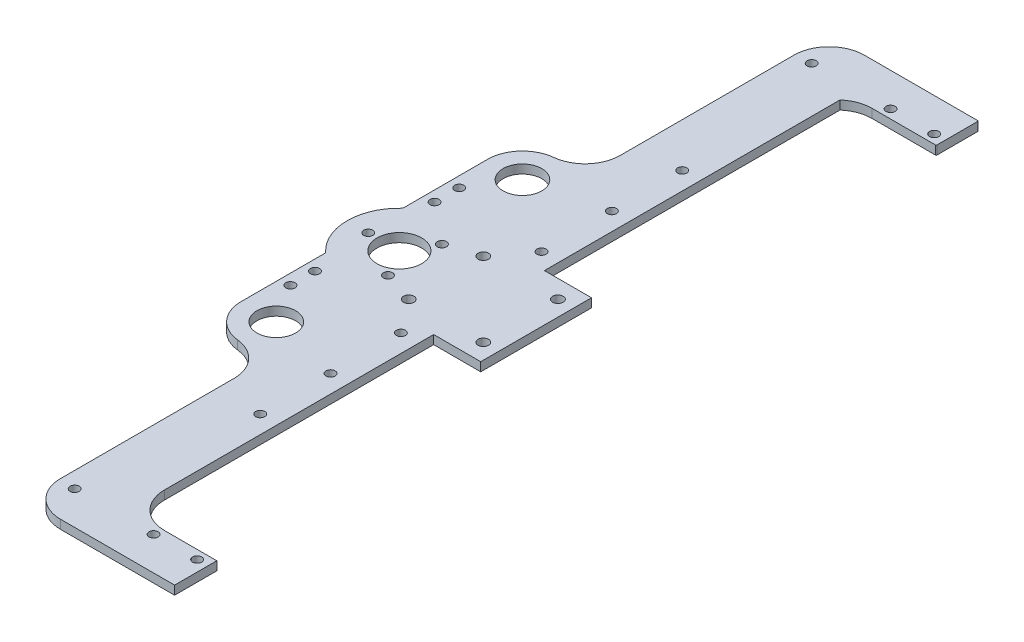
from build123d import *

# Parameters (mm, degrees)
SKETCH1_R           = 6.985
SKETCH1_R_2         = 1.6499967
SKETCH1_R_3         = 8.0645
BOSS_EXTRUDE1_DEPTH = 3.175
FILLET2_R           = 0.254
SKETCH4_R           = 1.65
CUT_EXTRUDE1_DEPTH  = 199.349545248
SKETCH5_R           = 1.89865
CUT_EXTRUDE2_DEPTH  = 199.349545248


with BuildPart() as part:
    # Sketch1 → Boss-Extrude1 (new body)
    with BuildSketch(Plane(origin=(0, 0, 0), x_dir=(1, 0, 0), z_dir=(0, 1, 0))):
        with BuildLine():
            ThreePointArc((-67.971311517, -24.866245744), (-74.128017531, -38.797272158), (-67.971311517, -52.728298572))
            Line((-67.971311517, -52.728298572), (-67.971311517, -82.586411585))
            ThreePointArc((-67.971311517, -82.586411585), (-64.941959488, -91.499608698), (-56.608448003, -95.878494725))
            ThreePointArc((-56.608448003, -95.878494725), (-48.492989851, -100.008926653), (-45.228378476, -108.509717293))
            Line((-45.228378476, -108.509717293), (-45.228378476, -171.249717293))
            ThreePointArc((-45.228378476, -171.249717293), (-41.508634597, -180.229973414), (-32.528378476, -183.949717293))
            Line((-32.528378476, -183.949717293), (7.398418219, -183.949717293))
            Line((7.398418219, -183.949717293), (8.682280525, -183.949717293))
            Line((8.682280525, -183.949717293), (8.682280525, -168.709717293))
            Line((8.682280525, -168.709717293), (-10.203517531, -168.709717293))
            ThreePointArc((-10.203517531, -168.709717293), (-19.183773652, -164.989973414), (-22.903517531, -156.009717293))
            Line((-22.903517531, -156.009717293), (-22.903517531, -64.197272158))
            Line((-22.903517531, -64.197272158), (-22.903517531, -58.797272158))
            Line((-22.903517531, -58.797272158), (-5.903517531, -58.797272158))
            Line((-5.903517531, -58.797272158), (-5.903517531, -38.797272158))
            Line((-5.903517531, -38.797272158), (-5.903517531, -18.797272158))
            Line((-5.903517531, -18.797272158), (-22.903517531, -18.797272158))
            Line((-22.903517531, -18.797272158), (-22.903517531, 87.951188553))
            ThreePointArc((-22.903517531, 87.951188553), (-18.998096245, 90.297878852), (-14.51576414, 91.115172977))
            Line((-14.51576414, 91.115172977), (8.682280525, 91.115172977))
            Line((8.682280525, 91.115172977), (8.682280525, 106.355172977))
            Line((8.682280525, 106.355172977), (-7.110618503, 106.355172977))
            Line((-7.110618503, 106.355172977), (-22.903517531, 106.355172977))
            Line((-22.903517531, 106.355172977), (-32.528378476, 106.355172977))
            ThreePointArc((-32.528378476, 106.355172977), (-41.508634597, 102.635429098), (-45.228378476, 93.655172977))
            Line((-45.228378476, 93.655172977), (-45.228378476, 30.915172977))
            ThreePointArc((-45.228378476, 30.915172977), (-48.492989851, 22.414382337), (-56.608448003, 18.28395041))
            ThreePointArc((-56.608448003, 18.28395041), (-64.941959488, 13.905064383), (-67.971311517, 4.991867269))
            Line((-67.971311517, 4.991867269), (-67.971311517, -24.866245744))
        make_face()
        with Locations((-55.288517531, -83.247272158)):
            Circle(SKETCH1_R, mode=Mode.SUBTRACT)
        with Locations((-64.161311517, -69.277272158)):
            Circle(SKETCH1_R_2, mode=Mode.SUBTRACT)
        with Locations((-64.161311517, -60.387272158)):
            Circle(SKETCH1_R_2, mode=Mode.SUBTRACT)
        with Locations((-66.528017531, -38.797272158)):
            Circle(SKETCH1_R_2, mode=Mode.SUBTRACT)
        with Locations((-55.288517531, -38.797272158)):
            Circle(SKETCH1_R_3, mode=Mode.SUBTRACT)
        with Locations((-49.668767531, -48.530964684)):
            Circle(SKETCH1_R_2, mode=Mode.SUBTRACT)
        with Locations((-29.342032123, -114.997272158)):
            Circle(SKETCH1_R_2, mode=Mode.SUBTRACT)
        with Locations((-29.342032123, -89.597272158)):
            Circle(SKETCH1_R_2, mode=Mode.SUBTRACT)
        with Locations((-29.342032123, -64.197272158)):
            Circle(SKETCH1_R_2, mode=Mode.SUBTRACT)
        with Locations((-64.161311517, -17.207272158)):
            Circle(SKETCH1_R_2, mode=Mode.SUBTRACT)
        with Locations((-64.161311517, -8.317272158)):
            Circle(SKETCH1_R_2, mode=Mode.SUBTRACT)
        with Locations((-55.288517531, 5.652727842)):
            Circle(SKETCH1_R, mode=Mode.SUBTRACT)
        with Locations((-49.668767531, -29.063579632)):
            Circle(SKETCH1_R_2, mode=Mode.SUBTRACT)
        with Locations((-29.342032123, -13.397272158)):
            Circle(SKETCH1_R_2, mode=Mode.SUBTRACT)
        with Locations((-29.342032123, 12.002727842)):
            Circle(SKETCH1_R_2, mode=Mode.SUBTRACT)
        with Locations((-29.342032123, 37.402727842)):
            Circle(SKETCH1_R_2, mode=Mode.SUBTRACT)
    extrude(amount=BOSS_EXTRUDE1_DEPTH)

    # Fillet2
    fillet2_edges = [part.edges().sort_by_distance(p)[0] for p in [
        (8.682280525, 1.5875, -91.115172977),
        (8.682280525, 1.5875, -106.355172977),
    ]]
    fillet(fillet2_edges, radius=FILLET2_R)

    # Sketch4 → Cut-Extrude1 (cut, through all)
    with BuildSketch(Plane(origin=(0, 3.175, 0), x_dir=(1, 0, 0), z_dir=(0, 1, 0))):
        with Locations((4.753970241, 94.290172977)):
            Circle(SKETCH4_R)
        with Locations((-10.971029759, 94.290172977)):
            Circle(SKETCH4_R)
        with Locations((-39.471029759, 94.290172977)):
            Circle(SKETCH4_R)
        with Locations((-39.471029759, -171.884717293)):
            Circle(SKETCH4_R)
        with Locations((-10.971029759, -171.884717293)):
            Circle(SKETCH4_R)
        with Locations((4.753970241, -171.884717293)):
            Circle(SKETCH4_R)
    extrude(amount=-CUT_EXTRUDE1_DEPTH, mode=Mode.SUBTRACT)

    # Sketch5 → Cut-Extrude2 (cut, through all)
    with BuildSketch(Plane(origin=(0, 3.175, 0), x_dir=(1, 0, 0), z_dir=(0, 1, 0))):
        with Locations((-11.500645577, -25.326887976)):
            Circle(SKETCH5_R)
        with Locations((-38.441413941, -25.326887976)):
            Circle(SKETCH5_R)
        with Locations((-38.441413941, -52.267656339)):
            Circle(SKETCH5_R)
        with Locations((-11.500645577, -52.267656339)):
            Circle(SKETCH5_R)
    extrude(amount=-CUT_EXTRUDE2_DEPTH, mode=Mode.SUBTRACT)


solid = part.part
